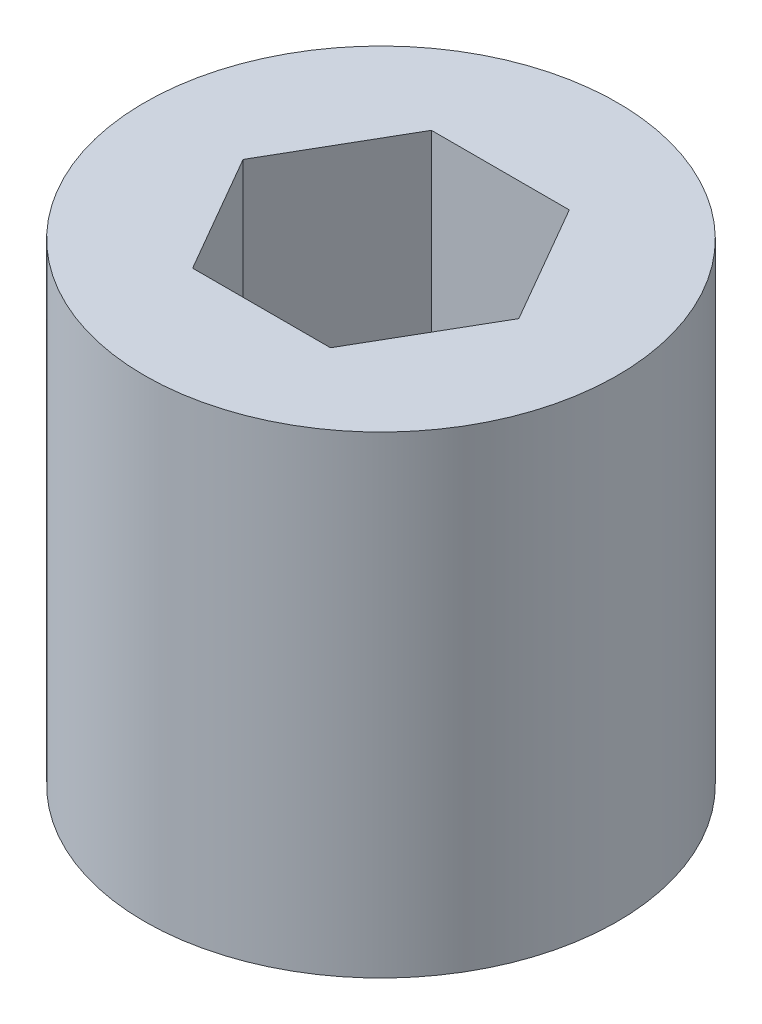
from build123d import *

# Parameters (mm, degrees)
SKETCH1_R           = 12.7
BOSS_EXTRUDE1_DEPTH = 25.4


with BuildPart() as part:
    # Sketch1 → Boss-Extrude1 (new body)
    with BuildSketch(Plane(origin=(0, 0, 0), x_dir=(1, 0, 0), z_dir=(0, 1, 0))):
        Circle(SKETCH1_R)
        Polygon((7.405671903, 0), (3.702835951, 6.4135), (-3.702835951, 6.4135), (-7.405671903, 0), (-3.702835951, -6.4135), (3.702835951, -6.4135), align=None, mode=Mode.SUBTRACT)
    extrude(amount=BOSS_EXTRUDE1_DEPTH)


solid = part.part
